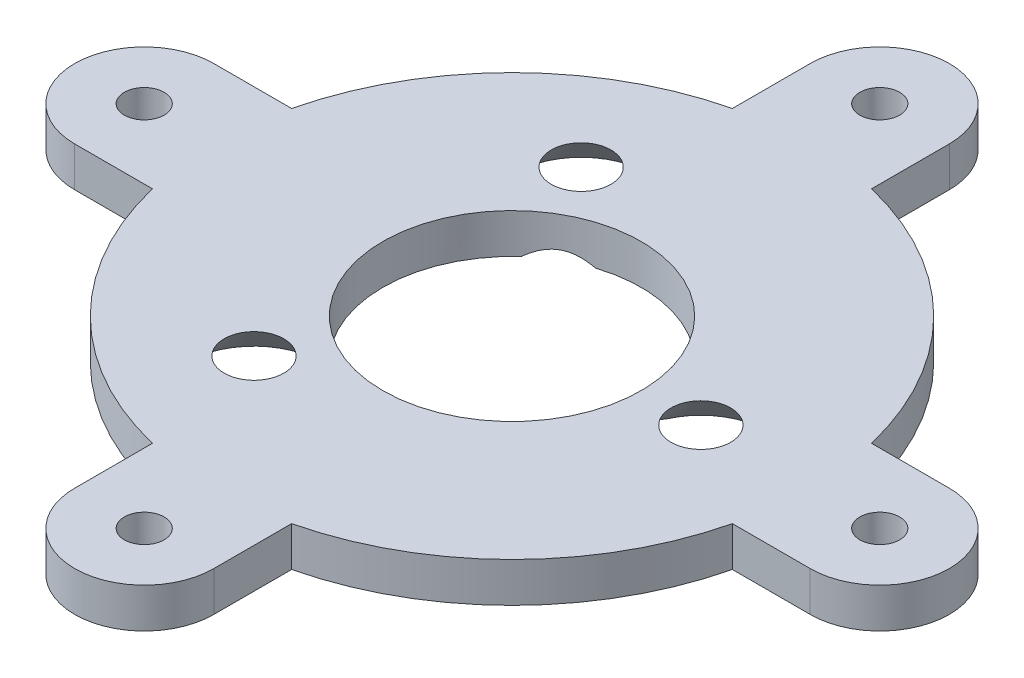
from build123d import *

# Parameters (mm, degrees)
SKETCH_2_R       = 15
SKETCH_2_R_2     = 6.5
SKETCH_2_R_3     = 1.5
EXTRUDE_1_DEPTH  = 2
CHAMFER_1_SIZE   = 2
CHAMFER_1_SIZE_2 = 1.93137755
SKETCH_3_R       = 1
EXTRUDE_2_DEPTH  = 2


with BuildPart() as part:
    # 草图2 → 凸台-拉伸1 (new body)
    with BuildSketch(Plane(origin=(0, 0, 0), x_dir=(1, 0, 0), z_dir=(0, 1, 0))):
        with Locations(Location((0, 0, 0), (0, 0, 270))):
            Circle(SKETCH_2_R)
        with Locations(Location((0, 0, 0), (0, 0, 270))):
            Circle(SKETCH_2_R_2, mode=Mode.SUBTRACT)
        with Locations(Location((9.5, 0, 0), (0, 0, 270))):
            Circle(SKETCH_2_R_3, mode=Mode.SUBTRACT)
        with Locations(Location((-4.75, -8.227241336, 0), (0, 0, 270))):
            Circle(SKETCH_2_R_3, mode=Mode.SUBTRACT)
        with Locations(Location((-4.75, 8.227241336, 0), (0, 0, 270))):
            Circle(SKETCH_2_R_3, mode=Mode.SUBTRACT)
    extrude(amount=EXTRUDE_1_DEPTH)

    # 倒角1
    # the kernel refuses this chamfer: 2, 1.93137755 mm, written as the material it takes off along each edge
    with BuildSketch(Plane(origin=(-4.75, 0, 8.227241336), x_dir=(0, 0, 1), z_dir=(-1, 0, 0))) as chamfer_1_piece_1:
        Polygon((1.5, CHAMFER_1_SIZE), (1.5 + CHAMFER_1_SIZE_2, 0), (1.5, 0), align=None)
    revolve(axis=Axis((-4.75, 0, 8.227241336), (0, 1, 0)), mode=Mode.SUBTRACT)
    with BuildSketch(Plane(origin=(-4.75, 0, -8.227241336), x_dir=(0, 0, 1), z_dir=(-1, 0, 0))) as chamfer_1_piece_2:
        Polygon((1.5, CHAMFER_1_SIZE), (1.5 + CHAMFER_1_SIZE_2, 0), (1.5, 0), align=None)
    revolve(axis=Axis((-4.75, 0, -8.227241336), (0, 1, 0)), mode=Mode.SUBTRACT)
    with BuildSketch(Plane(origin=(9.5, 0, 0), x_dir=(0, 0, 1), z_dir=(-1, 0, 0))) as chamfer_1_piece_3:
        Polygon((1.5, CHAMFER_1_SIZE), (1.5 + CHAMFER_1_SIZE_2, 0), (1.5, 0), align=None)
    revolve(axis=Axis((9.5, 0, 0), (0, 1, 0)), mode=Mode.SUBTRACT)

    # 草图3 → 凸台-拉伸2 (add)
    # profile 1 of 4: a face of its own
    with BuildSketch(Plane(origin=(0, 0, 0), x_dir=(1, 0, 0), z_dir=(0, 1, 0))):
        with BuildLine():
            Line((-18.5, -3.5), (-14.585952146, -3.5))
            ThreePointArc((-14.585952146, -3.5), (-15, 0), (-14.585952146, 3.5))
            Line((-14.585952146, 3.5), (-18.5, 3.5))
            ThreePointArc((-18.5, 3.5), (-22, 0), (-18.5, -3.5))
        make_face()
        with Locations(Location((-18.5, 0, 0), (0, 0, 270))):
            Circle(SKETCH_3_R, mode=Mode.SUBTRACT)
    # profile 2 of 4: a face of its own
    with BuildSketch(Plane(origin=(0, 0, 0), x_dir=(1, 0, 0), z_dir=(0, 1, 0))):
        with BuildLine():
            Line((-3.5, 18.5), (-3.5, 14.585952146))
            ThreePointArc((-3.5, 14.585952146), (0, 15), (3.5, 14.585952146))
            Line((3.5, 14.585952146), (3.5, 18.5))
            ThreePointArc((3.5, 18.5), (0, 22), (-3.5, 18.5))
        make_face()
        with Locations(Location((0, 18.5, 0), (0, 0, 270))):
            Circle(SKETCH_3_R, mode=Mode.SUBTRACT)
    # profile 3 of 4: a face of its own
    with BuildSketch(Plane(origin=(0, 0, 0), x_dir=(1, 0, 0), z_dir=(0, 1, 0))):
        with BuildLine():
            Line((18.5, 3.5), (14.585952146, 3.5))
            ThreePointArc((14.585952146, 3.5), (15, 0), (14.585952146, -3.5))
            Line((14.585952146, -3.5), (18.5, -3.5))
            ThreePointArc((18.5, -3.5), (22, 0), (18.5, 3.5))
        make_face()
        with Locations(Location((18.5, 0, 0), (0, 0, 270))):
            Circle(SKETCH_3_R, mode=Mode.SUBTRACT)
    # profile 4 of 4: a face of its own
    with BuildSketch(Plane(origin=(0, 0, 0), x_dir=(1, 0, 0), z_dir=(0, 1, 0))):
        with BuildLine():
            Line((3.5, -18.5), (3.5, -14.585952146))
            ThreePointArc((3.5, -14.585952146), (0, -15), (-3.5, -14.585952146))
            Line((-3.5, -14.585952146), (-3.5, -18.5))
            ThreePointArc((-3.5, -18.5), (0, -22), (3.5, -18.5))
        make_face()
        with Locations(Location((0, -18.5, 0), (0, 0, 270))):
            Circle(SKETCH_3_R, mode=Mode.SUBTRACT)
    extrude(amount=EXTRUDE_2_DEPTH)


solid = part.part
